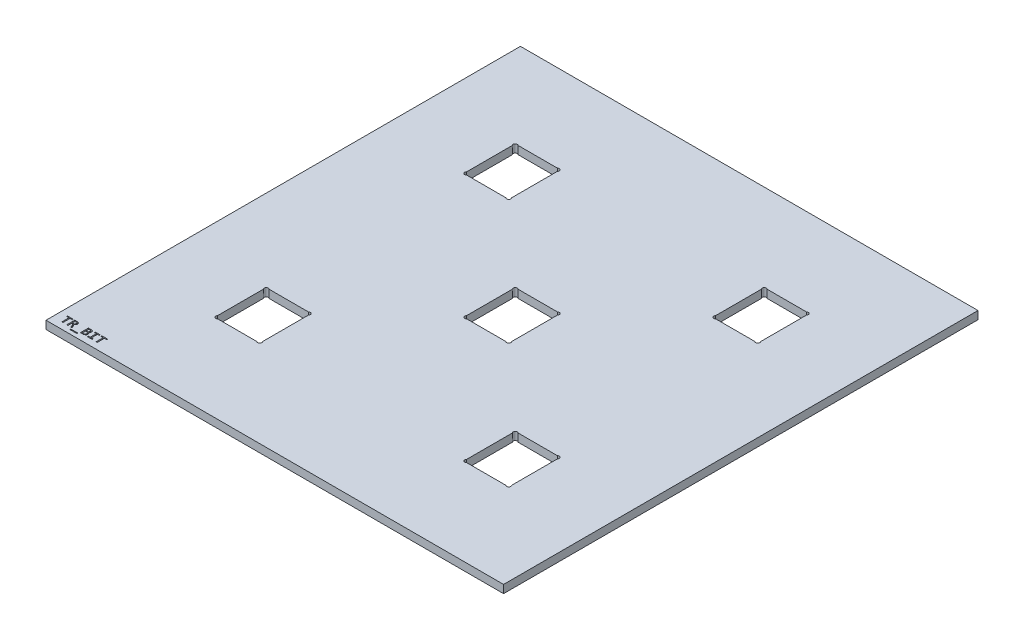
from build123d import *

# Parameters (mm, degrees)
SKETCH1_W           = 180.848
SKETCH1_H           = 187.5155
BOSS_EXTRUDE1_DEPTH = 3.175
SKETCH2_W           = 17.78
SKETCH2_H           = 20.32
CUT_EXTRUDE1_DEPTH  = 3.175
SKETCH3_R           = 0.79375
CUT_EXTRUDE2_DEPTH  = 131.296186
SKETCH4_W           = 2.714855072
SKETCH4_H           = 0.368115942
CUT_EXTRUDE3_DEPTH  = 1.5875


with BuildPart() as part:
    # Sketch1 → Boss-Extrude1 (new body)
    with BuildSketch(Plane(origin=(0, 0, 0), x_dir=(1, 0, 0), z_dir=(0, 1, 0))):
        Rectangle(SKETCH1_W, SKETCH1_H)
    extrude(amount=BOSS_EXTRUDE1_DEPTH)

    # Sketch2 → Cut-Extrude1 (cut)
    with BuildSketch(Plane(origin=(0, 3.175, 0), x_dir=(1, 0, 0), z_dir=(0, 1, 0))):
        Rectangle(SKETCH2_W, SKETCH2_H)
    cut_extrude1 = extrude(amount=-CUT_EXTRUDE1_DEPTH, mode=Mode.SUBTRACT)

    # Sketch3 → Cut-Extrude2 (cut, through all)
    with BuildSketch(Plane(origin=(0, 3.175, 0), x_dir=(1, 0, 0), z_dir=(0, 1, 0))):
        with Locations((8.328733992, -9.598733992)):
            Circle(SKETCH3_R)
        with Locations((-8.328733992, -9.598733992)):
            Circle(SKETCH3_R)
        with Locations((-8.328733992, 9.598733992)):
            Circle(SKETCH3_R)
        with Locations((8.328733992, 9.598733992)):
            Circle(SKETCH3_R)
    cut_extrude2 = extrude(amount=-CUT_EXTRUDE2_DEPTH, mode=Mode.SUBTRACT)

    # Sketch-Pattern1: Cut-Extrude1, Cut-Extrude2 at 4 more places
    with Locations((-49.2125, 0, 49.2125), (-49.2125, 0, -49.2125), (49.2125, 0, -49.2125), (49.2125, 0, 49.2125)):
        add(cut_extrude1, mode=Mode.SUBTRACT)
        add(cut_extrude2, mode=Mode.SUBTRACT)

    # Sketch4 → Cut-Extrude3 (cut)
    # profile 1 of 6: a face of its own
    with BuildSketch(Plane(origin=(0, 3.175, 0), x_dir=(1, 0, 0), z_dir=(0, 1, 0))):
        Polygon((-85.353202899, -88.410865942), (-86.273492754, -88.410865942), (-86.273492754, -91.21775), (-86.733637681, -91.21775), (-86.733637681, -88.410865942), (-87.653927536, -88.410865942), (-87.653927536, -88.04275), (-85.353202899, -88.04275), align=None)
    # profile 2 of 6: a face of its own
    with BuildSketch(Plane(origin=(0, 3.175, 0), x_dir=(1, 0, 0), z_dir=(0, 1, 0))):
        with BuildLine():
            Line((-82.638347826, -91.21775), (-83.125813859, -91.21775))
            Line((-83.125813859, -91.21775), (-83.582363904, -90.226281476))
            add(Edge.make_bspline(
                [(-83.582363904, -90.226281476), (-83.598860974, -90.191130284), (-83.629465089, -90.125920458), (-83.683350175, -90.040294449), (-83.73916016, -89.971305876), (-83.799615044, -89.918268069), (-83.865569382, -89.879574558), (-83.937441008, -89.854540538), (-84.016272547, -89.839988328), (-84.071201483, -89.838235213), (-84.100026947, -89.837315217)],
                knots=[0, 0, 0, 0, 1.339134837, 2.484261414, 3.482991323, 4.391871607, 5.244507385, 6.105289549, 7.005698766, 8, 8, 8, 8], degree=3))
            Line((-84.100026947, -89.837315217), (-84.294869565, -89.837315217))
            Line((-84.294869565, -89.837315217), (-84.294869565, -91.21775))
            Line((-84.294869565, -91.21775), (-84.755014493, -91.21775))
            Line((-84.755014493, -91.21775), (-84.755014493, -88.04275))
            Line((-84.755014493, -88.04275), (-83.910936141, -88.04275))
            add(Edge.make_bspline(
                [(-83.910936141, -88.04275), (-83.866571096, -88.043324801), (-83.781034279, -88.044433032), (-83.657527264, -88.056115686), (-83.543677978, -88.074962175), (-83.439661951, -88.102534986), (-83.344774287, -88.136226928), (-83.258689811, -88.176489474), (-83.181396775, -88.223089264), (-83.113190469, -88.276260019), (-83.052893824, -88.334285294), (-83.002293397, -88.399280748), (-82.959385051, -88.469287391), (-82.925710385, -88.545372647), (-82.900177177, -88.626034235), (-82.88111807, -88.710889782), (-82.870477515, -88.800037309), (-82.869113537, -88.860918232), (-82.86842029, -88.891861187)],
                knots=[0, 0, 0, 0, 1.390037284, 2.680023546, 3.883960013, 5.002565466, 6.047913656, 7.03574216, 7.976084698, 8.870016629, 9.741095147, 10.591561451, 11.444313202, 12.308368875, 13.191986167, 14.092206828, 15.030357037, 16, 16, 16, 16], degree=3))
            add(Edge.make_bspline(
                [(-82.86842029, -88.891861187), (-82.868994868, -88.916809205), (-82.870124847, -88.965872567), (-82.878430329, -89.038414802), (-82.89100624, -89.108963136), (-82.909849703, -89.177190844), (-82.933612198, -89.242831971), (-82.962310371, -89.305834559), (-82.997136135, -89.36550299), (-83.036557213, -89.422458811), (-83.081411438, -89.475782218), (-83.130948802, -89.525652899), (-83.18635394, -89.570899919), (-83.245486917, -89.613413484), (-83.309965112, -89.651029424), (-83.379136935, -89.683170015), (-83.452650391, -89.710818718), (-83.503864807, -89.724616993), (-83.529878623, -89.731625679)],
                knots=[0, 0, 0, 0, 1.032708305, 2.030948508, 3.019625047, 3.996933367, 4.957424013, 5.907556856, 6.85893238, 7.814077788, 8.77200233, 9.740252168, 10.719774328, 11.730219428, 12.753012585, 13.805036997, 14.885091985, 16, 16, 16, 16], degree=3))
            add(Edge.make_bspline(
                [(-83.529878623, -89.731625679), (-83.508734767, -89.739380778), (-83.466783942, -89.754767413), (-83.409104807, -89.789031767), (-83.354855427, -89.828859176), (-83.307413111, -89.879758478), (-83.261027139, -89.937088784), (-83.215047309, -90.003148469), (-83.168355492, -90.077696238), (-83.138952467, -90.131452504), (-83.123656929, -90.159416667)],
                knots=[0, 0, 0, 0, 0.890820497, 1.767447404, 2.649001527, 3.549193506, 4.515009134, 5.571837998, 6.736863216, 8, 8, 8, 8], degree=3))
            Line((-83.123656929, -90.159416667), (-82.638347826, -91.21775))
        make_face()
        with BuildLine():
            add(Edge.make_bspline(
                [(-83.328565217, -88.922777174), (-83.328901843, -88.901906114), (-83.32955407, -88.861467484), (-83.336773162, -88.802931226), (-83.34912625, -88.74858325), (-83.365581675, -88.698221992), (-83.386140981, -88.651372969), (-83.413407518, -88.609650848), (-83.444183923, -88.571263632), (-83.479733549, -88.537216471), (-83.519769509, -88.507597987), (-83.563758214, -88.481855754), (-83.611291845, -88.459414038), (-83.662835579, -88.441302724), (-83.718322956, -88.428061778), (-83.777599298, -88.41773837), (-83.840852671, -88.41224996), (-83.884324813, -88.411335157), (-83.906622283, -88.410865942)],
                knots=[0, 0, 0, 0, 1.136086502, 2.201219443, 3.204852043, 4.166451082, 5.083443327, 5.98129036, 6.87199526, 7.758098985, 8.653381414, 9.577773354, 10.529401831, 11.511765708, 12.546811162, 13.632454437, 14.78565276, 16, 16, 16, 16], degree=3))
            Line((-83.906622283, -88.410865942), (-84.294869565, -88.410865942))
            Line((-84.294869565, -88.410865942), (-84.294869565, -89.469199275))
            Line((-84.294869565, -89.469199275), (-83.961983469, -89.469199275))
            add(Edge.make_bspline(
                [(-83.961983469, -89.469199275), (-83.93824743, -89.468775061), (-83.891881464, -89.467946402), (-83.824245057, -89.461800526), (-83.760525642, -89.449675605), (-83.700090994, -89.435336816), (-83.643820366, -89.415000628), (-83.592001738, -89.390397511), (-83.543763099, -89.362541635), (-83.500833591, -89.329095915), (-83.461473321, -89.292318472), (-83.427024794, -89.251260372), (-83.397057325, -89.206291797), (-83.372862702, -89.156799379), (-83.3522013, -89.103890377), (-83.339197548, -89.046440031), (-83.330033673, -88.985862033), (-83.329062587, -88.944144192), (-83.328565217, -88.922777174)],
                knots=[0, 0, 0, 0, 1.202615583, 2.349188572, 3.435207305, 4.486530095, 5.492783739, 6.45958443, 7.390413995, 8.308405015, 9.210274755, 10.115082188, 11.017605575, 11.940721498, 12.901403136, 13.887978084, 14.918265918, 16, 16, 16, 16], degree=3))
        make_face(mode=Mode.SUBTRACT)
    # profile 3 of 6: a face of its own
    with BuildSketch(Plane(origin=(0, 3.175, 0), x_dir=(1, 0, 0), z_dir=(0, 1, 0))):
        with Locations((-81.096862319, -92.04601087)):
            Rectangle(SKETCH4_W, SKETCH4_H)
    # profile 4 of 6: a face of its own
    with BuildSketch(Plane(origin=(0, 3.175, 0), x_dir=(1, 0, 0), z_dir=(0, 1, 0))):
        with BuildLine():
            add(Edge.make_bspline(
                [(-77.300666667, -90.256478487), (-77.301767408, -90.293929266), (-77.303916628, -90.367052676), (-77.320759558, -90.473189263), (-77.348005833, -90.573001284), (-77.38692422, -90.665931999), (-77.43648218, -90.751801926), (-77.493981353, -90.831853883), (-77.562241143, -90.903949147), (-77.6396186, -90.968793102), (-77.725718864, -91.026528496), (-77.820300053, -91.076706576), (-77.923229564, -91.120132703), (-78.034429642, -91.155730594), (-78.15300213, -91.183451777), (-78.278120993, -91.203821947), (-78.409843128, -91.214989694), (-78.49989964, -91.216816295), (-78.545933877, -91.21775)],
                knots=[0, 0, 0, 0, 1.013216857, 1.978326566, 2.900521816, 3.80762901, 4.696652207, 5.578905641, 6.469134838, 7.376056482, 8.306156408, 9.269586241, 10.269510869, 11.325927403, 12.425683058, 13.562442612, 14.753992443, 16, 16, 16, 16], degree=3))
            Line((-78.545933877, -91.21775), (-79.371318841, -91.21775))
            Line((-79.371318841, -91.21775), (-79.371318841, -88.04275))
            Line((-79.371318841, -88.04275), (-78.458937726, -88.04275))
            add(Edge.make_bspline(
                [(-78.458937726, -88.04275), (-78.415776923, -88.043171305), (-78.332222251, -88.043986906), (-78.211327188, -88.05393778), (-78.098609009, -88.067679445), (-77.994182637, -88.088203549), (-77.898285108, -88.115948787), (-77.809991763, -88.147610533), (-77.730514356, -88.186599133), (-77.659442607, -88.23147315), (-77.596067661, -88.28174973), (-77.541935424, -88.339261014), (-77.495367382, -88.402028876), (-77.457743947, -88.471343702), (-77.428163159, -88.546400313), (-77.407445232, -88.627549956), (-77.395186792, -88.714378614), (-77.393541304, -88.774148172), (-77.392695652, -88.804865036)],
                knots=[0, 0, 0, 0, 1.388776146, 2.688521212, 3.90167895, 5.042289038, 6.109239049, 7.11226345, 8.057476407, 8.951978552, 9.813306123, 10.653548746, 11.486644475, 12.322022467, 13.184316581, 14.076721024, 15.011585489, 16, 16, 16, 16], degree=3))
            add(Edge.make_bspline(
                [(-77.392695652, -88.804865036), (-77.394187829, -88.845716953), (-77.397092057, -88.925227163), (-77.420465455, -89.040231165), (-77.459482567, -89.146199347), (-77.504703675, -89.227097931), (-77.548888272, -89.286037834), (-77.587262923, -89.327182959), (-77.63058913, -89.365156859), (-77.678325997, -89.400685977), (-77.731080807, -89.433021183), (-77.788816355, -89.462453202), (-77.851312239, -89.489051092), (-77.895156559, -89.503989589), (-77.91754846, -89.511618886)],
                knots=[0, 0, 0, 0, 1.542514348, 3.00220039, 4.41170875, 5.794260582, 6.486040375, 7.190794555, 7.915677968, 8.659981338, 9.436469499, 10.250434215, 11.106472525, 12, 12, 12, 12], degree=3))
            add(Edge.make_bspline(
                [(-77.91754846, -89.511618886), (-77.87664368, -89.52138252), (-77.794952297, -89.540881581), (-77.69877587, -89.584147488), (-77.626119669, -89.625464199), (-77.575453465, -89.662078725), (-77.52784107, -89.702208006), (-77.483872937, -89.7470422), (-77.44350785, -89.795968992), (-77.407265864, -89.849224875), (-77.376677228, -89.907458977), (-77.348810265, -89.96901986), (-77.327568021, -90.035403794), (-77.311528408, -90.105578127), (-77.302101832, -90.179769245), (-77.30115142, -90.230568553), (-77.300666667, -90.256478487)],
                knots=[0, 0, 0, 0, 1.670885493, 3.336943679, 4.174711656, 4.995358125, 5.821090152, 6.65083528, 7.491206374, 8.34319308, 9.209637874, 10.10658404, 11.029731221, 11.978595832, 12.968992875, 14, 14, 14, 14], degree=3))
        make_face()
        with BuildLine():
            add(Edge.make_bspline(
                [(-77.85284058, -88.864540082), (-77.854161122, -88.833734621), (-77.856753897, -88.773250649), (-77.875402457, -88.700093166), (-77.897242037, -88.645331886), (-77.919347424, -88.60738698), (-77.947588932, -88.572860108), (-77.980772524, -88.541382551), (-78.019214895, -88.512019396), (-78.064494712, -88.487086054), (-78.115808229, -88.464860097), (-78.173491667, -88.445492372), (-78.238113978, -88.42957659), (-78.31047592, -88.41815795), (-78.390767081, -88.41204341), (-78.446944803, -88.411269086), (-78.476193161, -88.410865942)],
                knots=[0, 0, 0, 0, 1.467350645, 2.88102155, 3.572915596, 4.274650825, 4.965411238, 5.692918483, 6.45179769, 7.26549663, 8.150919223, 9.115896111, 10.16367939, 11.321101063, 12.605258578, 14, 14, 14, 14], degree=3))
            Line((-78.476193161, -88.410865942), (-78.911173913, -88.410865942))
            Line((-78.911173913, -88.410865942), (-78.911173913, -89.37717029))
            Line((-78.911173913, -89.37717029), (-78.49057269, -89.37717029))
            add(Edge.make_bspline(
                [(-78.49057269, -89.37717029), (-78.444696492, -89.375694942), (-78.356911508, -89.372871835), (-78.250692628, -89.35378391), (-78.173249825, -89.331332692), (-78.121468475, -89.308054353), (-78.072480474, -89.283616777), (-78.028835265, -89.252923081), (-77.988728878, -89.219097156), (-77.953534545, -89.180905973), (-77.92287595, -89.138813833), (-77.897680681, -89.092359062), (-77.877342165, -89.041771711), (-77.863140955, -88.986682116), (-77.854316788, -88.927136465), (-77.853344367, -88.885902411), (-77.85284058, -88.864540082)],
                knots=[0, 0, 0, 0, 2.073538655, 3.967755928, 4.862618563, 5.712230629, 6.531505899, 7.334196252, 8.118305519, 8.900614993, 9.67674368, 10.467342855, 11.284464589, 12.136217, 13.034420764, 14, 14, 14, 14], degree=3))
        make_face(mode=Mode.SUBTRACT)
        with BuildLine():
            add(Edge.make_bspline(
                [(-77.760811594, -90.273014946), (-77.761288763, -90.253085269), (-77.762225678, -90.213953551), (-77.771847595, -90.156726005), (-77.78761894, -90.102682223), (-77.809520058, -90.051850198), (-77.836570675, -90.004209361), (-77.870248318, -89.960957686), (-77.90863738, -89.92069802), (-77.953307965, -89.885006521), (-78.00326612, -89.853546666), (-78.057735842, -89.825120785), (-78.117411303, -89.80079497), (-78.182173689, -89.780869375), (-78.251622709, -89.764982077), (-78.325406869, -89.753843571), (-78.403656965, -89.746206424), (-78.457240624, -89.745598922), (-78.484820879, -89.745286232)],
                knots=[0, 0, 0, 0, 0.948445084, 1.862262358, 2.754366203, 3.623615494, 4.492864785, 5.355796555, 6.227589923, 7.136690505, 8.070741307, 9.035595869, 10.059344591, 11.135152229, 12.259281394, 13.44900263, 14.686966176, 16, 16, 16, 16], degree=3))
            Line((-78.484820879, -89.745286232), (-78.911173913, -89.745286232))
            Line((-78.911173913, -89.745286232), (-78.911173913, -90.849634058))
            Line((-78.911173913, -90.849634058), (-78.47044135, -90.849634058))
            add(Edge.make_bspline(
                [(-78.47044135, -90.849634058), (-78.441427747, -90.849264013), (-78.385480287, -90.848550449), (-78.304349458, -90.84185132), (-78.228786402, -90.831613893), (-78.159194988, -90.815617802), (-78.095172075, -90.79622008), (-78.036524019, -90.772887579), (-77.984110327, -90.74375948), (-77.936450768, -90.711542959), (-77.895152566, -90.673498072), (-77.858799326, -90.63098716), (-77.828566956, -90.582834844), (-77.803342481, -90.530299179), (-77.783834378, -90.472855434), (-77.770317732, -90.410634095), (-77.762520159, -90.343433535), (-77.761393583, -90.297001648), (-77.760811594, -90.273014946)],
                knots=[0, 0, 0, 0, 1.326701194, 2.558302104, 3.720902774, 4.811133236, 5.820090824, 6.778795896, 7.691204955, 8.557756331, 9.403467856, 10.251165954, 11.10865784, 11.996033528, 12.91113804, 13.8765245, 14.903013039, 16, 16, 16, 16], degree=3))
        make_face(mode=Mode.SUBTRACT)
    # profile 5 of 6: a face of its own
    with BuildSketch(Plane(origin=(0, 3.175, 0), x_dir=(1, 0, 0), z_dir=(0, 1, 0))):
        Polygon((-75.874217391, -88.410865942), (-76.610449275, -88.410865942), (-76.610449275, -88.04275), (-74.67784058, -88.04275), (-74.67784058, -88.410865942), (-75.414072464, -88.410865942), (-75.414072464, -90.849634058), (-74.67784058, -90.849634058), (-74.67784058, -91.21775), (-76.610449275, -91.21775), (-76.610449275, -90.849634058), (-75.874217391, -90.849634058), align=None)
    # profile 6 of 6: a face of its own
    with BuildSketch(Plane(origin=(0, 3.175, 0), x_dir=(1, 0, 0), z_dir=(0, 1, 0))):
        Polygon((-71.778927536, -88.410865942), (-72.699217391, -88.410865942), (-72.699217391, -91.21775), (-73.159362319, -91.21775), (-73.159362319, -88.410865942), (-74.079652174, -88.410865942), (-74.079652174, -88.04275), (-71.778927536, -88.04275), align=None)
    extrude(amount=-CUT_EXTRUDE3_DEPTH, mode=Mode.SUBTRACT)


solid = part.part
